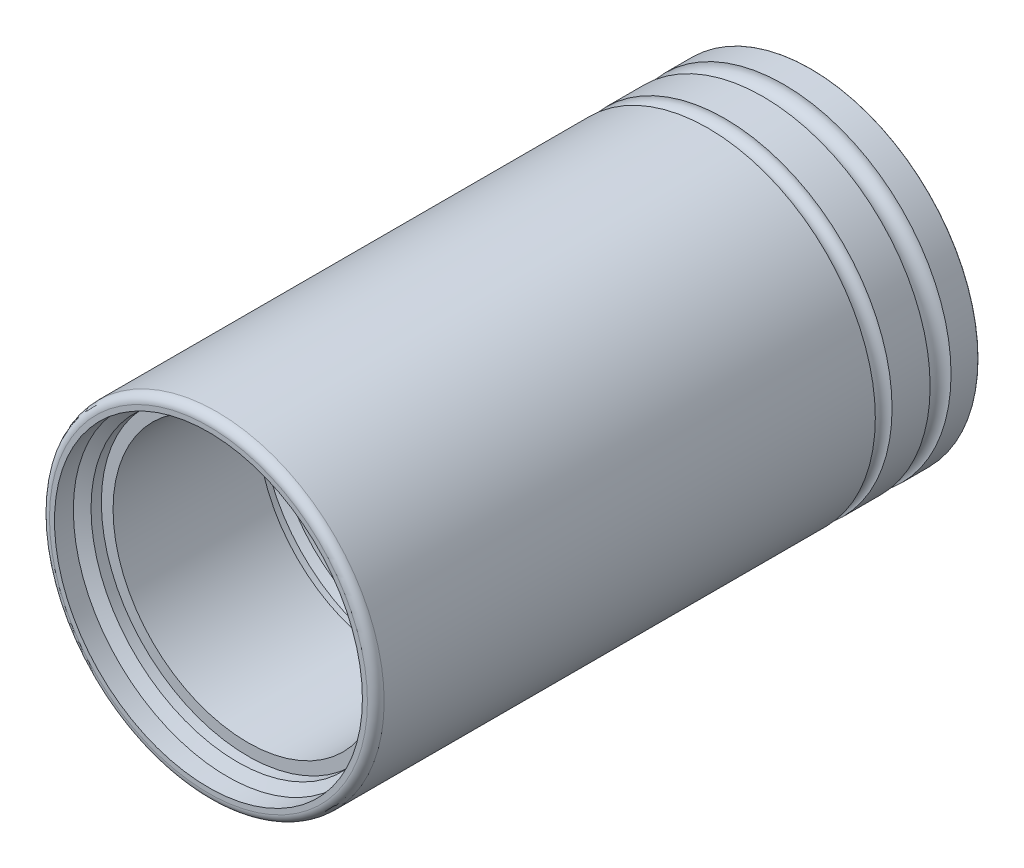
from build123d import *

# Parameters (mm, degrees)
SKETCH_1_R          = 20
EXTRUDE_1_DEPTH     = 72
FILLET_2_R          = 1
SKETCH_6_R          = 18.4
CUT_EXTRUDE_1_DEPTH = 2.6
FILLET_3_R          = 0.05
SKETCH_8_R          = 1.25
SKETCH_8_R_2        = 1


with BuildPart() as part:
    # Эскиз1 → Бобышка-Вытянуть1 (new body)
    with BuildSketch(Plane.XY):
        Circle(SKETCH_1_R)
    extrude(amount=-EXTRUDE_1_DEPTH)

    # Эскиз4 → Вырез-Повернуть1 (revolve, cut)
    with BuildSketch(Plane(origin=(0, 0, 0), x_dir=(0, 0, -1), z_dir=(1, 0, 0))):
        with BuildLine():
            Line((0, 0), (0, 17.5))
            Line((0, 17.5), (4.7, 17.5))
            Line((4.7, 17.5), (4.7, 16.1))
            Line((4.7, 16.1), (22, 16.1))
            Line((22, 16.1), (22, 17.1))
            Line((22, 17.1), (23.4, 17.1))
            Line((23.4, 17.1), (23.977350269, 16.1))
            Line((23.977350269, 16.1), (30.3, 16.1))
            Line((30.3, 16.1), (30.3, 18))
            Line((30.3, 18), (33.5, 18))
            Line((33.5, 18), (33.5, 16.1))
            Line((33.5, 16.1), (47, 16.1))
            Line((47, 16.1), (47, 6))
            Line((47, 6), (49, 6))
            Line((49, 6), (49, 9.5))
            Line((49, 9.5), (52.8, 9.5))
            ThreePointArc((52.8, 9.5), (53.4, 10.1), (54, 9.5))
            Line((54, 9.5), (55.5, 9.5))
            Line((55.5, 9.5), (55.5, 10.75))
            Line((55.5, 10.75), (67, 10.75))
            Line((67, 10.75), (67, 12.4))
            Line((67, 12.4), (70, 12.4))
            Line((70, 12.4), (70, 10.75))
            Line((70, 10.75), (72, 10.75))
            Line((72, 10.75), (72, 0))
            Line((72, 0), (0, 0))
        make_face()
    revolve(axis=Axis((0, 0, -72), (0, 0, 1)), mode=Mode.SUBTRACT)

    # Эскиз5 → Вырез-Повернуть2 (revolve, cut)
    with BuildSketch(Plane(origin=(0, 0, 0), x_dir=(0, 0, -1), z_dir=(1, 0, 0))):
        Polygon((3.466025404, 17.5), (1.733974596, 17.5), (2.6, 19), align=None)
    revolve(axis=Axis((0, 0, 0), (0, 0, -1)), mode=Mode.SUBTRACT)

    # Скругление2
    fillet_2_edges = [part.edges().sort_by_distance(p)[0] for p in [
        (-20, 0, 0),
    ]]
    fillet(fillet_2_edges, radius=FILLET_2_R)

    # Эскиз6 → Вырез-Вытянуть1 (cut)
    with BuildSketch(Plane.XY):
        Circle(SKETCH_6_R)
    extrude(amount=-CUT_EXTRUDE_1_DEPTH, mode=Mode.SUBTRACT)

    # Скругление3
    fillet_3_edges = [part.edges().sort_by_distance(p)[0] for p in [
        (0, -10.75, -72),
        (-20, 0, -72),
        (0, -6, -49),
    ]]
    fillet(fillet_3_edges, radius=FILLET_3_R)

    # Эскиз7 → Повернуть1 (revolve)
    with BuildSketch(Plane(origin=(0, 0, 0), x_dir=(1, 0, 0), z_dir=(0, 1, 0))):
        with BuildLine():
            Line((-15.75, 72), (-13.25, 72))
            ThreePointArc((-13.25, 72), (-14.5, 73.25), (-15.75, 72))
        make_face()
    revolve(axis=Axis((0, 0, -88.958875933), (0, 0, 1)))

    # Эскиз8 → Вырез-Повернуть3 (revolve, cut)
    with BuildSketch(Plane(origin=(0, 0, 0), x_dir=(0, 0, -1), z_dir=(1, 0, 0))):
        with Locations((67.5, 20)):
            Circle(SKETCH_8_R)
        with Locations((60.7, 20)):
            Circle(SKETCH_8_R_2)
    revolve(axis=Axis((0, 0, 0), (0, 0, -1)), mode=Mode.SUBTRACT)


solid = part.part
